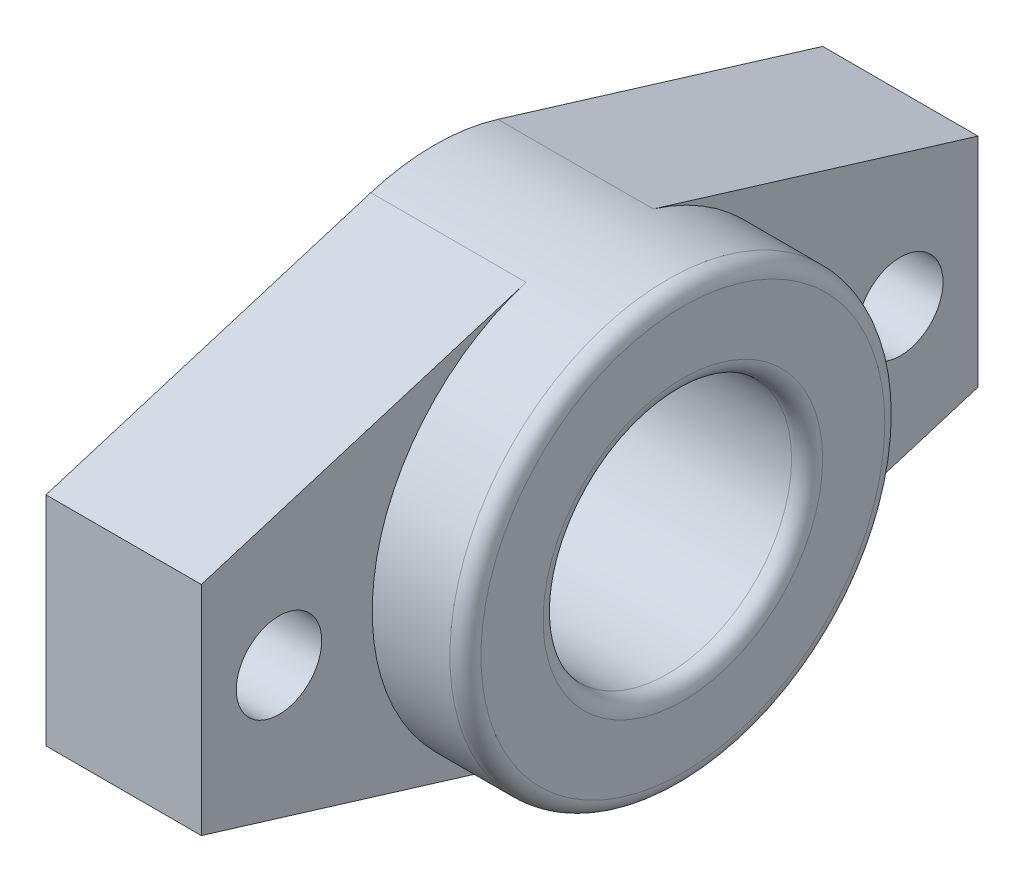
from build123d import *

# Parameters (mm, degrees)
BOSS_EXTRUDE1_DEPTH = 10
SKETCH3_R           = 14
BOSS_EXTRUDE2_DEPTH = 6
SKETCH4_R           = 2.75
SKETCH4_R_2         = 8
CUT_EXTRUDE1_DEPTH  = 16
FILLET1_R           = 1


with BuildPart() as part:
    # Sketch2 → Boss-Extrude1 (new body)
    with BuildSketch(Plane(origin=(0, 0, 0), x_dir=(0, 0, -1), z_dir=(1, 0, 0))):
        with BuildLine():
            Line((50, 7), (29.091106, 0.611092))
            ThreePointArc((29.091106, 0.611092), (25, 0), (20.908894, 0.611092))
            Line((20.908894, 0.611092), (0, 7))
            Line((0, 7), (0, 21))
            Line((0, 21), (20.908894, 27.388908))
            ThreePointArc((20.908894, 27.388908), (25, 28), (29.091106, 27.388908))
            Line((29.091106, 27.388908), (50, 21))
            Line((50, 21), (50, 7))
        make_face()
    extrude(amount=BOSS_EXTRUDE1_DEPTH)

    # Sketch3 → Boss-Extrude2 (add)
    with BuildSketch(Plane(origin=(10, 0, 0), x_dir=(0, 0, -1), z_dir=(1, 0, 0))):
        with Locations((25, 14)):
            Circle(SKETCH3_R)
    extrude(amount=BOSS_EXTRUDE2_DEPTH)

    # Sketch4 → Cut-Extrude1 (cut)
    with BuildSketch(Plane.ZY):
        with Locations((-45, 14)):
            Circle(SKETCH4_R)
        with Locations((-25, 14)):
            Circle(SKETCH4_R_2)
        with Locations((-5, 14)):
            Circle(SKETCH4_R)
    extrude(amount=-CUT_EXTRUDE1_DEPTH, mode=Mode.SUBTRACT)

    # Fillet1
    fillet1_edges = [part.edges().sort_by_distance(p)[0] for p in [
        (16, 14, -33),
        (16, 14, -11),
    ]]
    fillet(fillet1_edges, radius=FILLET1_R)


solid = part.part
